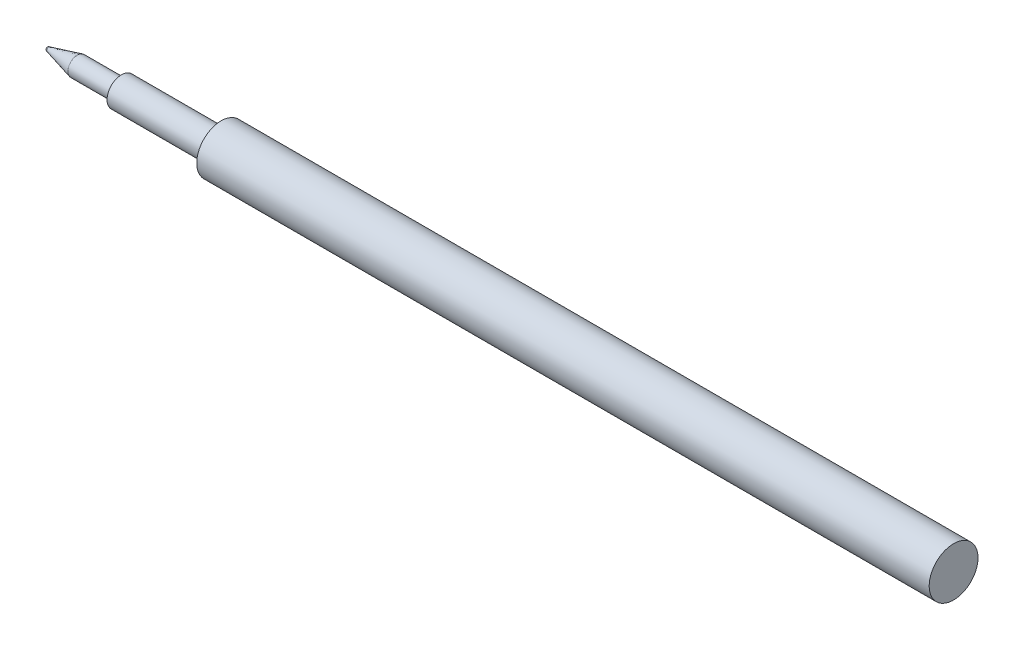
from build123d import *


with BuildPart() as part:
    # Sketch1 → Revolve1 (revolve)
    with BuildSketch(Plane.XY):
        with BuildLine():
            Line((-90, 3), (-90, 1.77))
            Line((-90, 1.77), (-102.25, 1.77))
            Line((-102.25, 1.77), (-102.25, 1.16))
            Line((-102.25, 1.16), (-107.67, 1.16))
            Line((-107.67, 1.16), (-111.17, 0.25))
            ThreePointArc((-111.17, 0.25), (-111.346776695, 0.176776695), (-111.42, 0))
            Line((-111.42, 0), (0, 0))
            Line((0, 0), (0, 3))
            Line((0, 3), (-90, 3))
        make_face()
    revolve(axis=Axis((0, 0, 0), (-1, 0, 0)))


solid = part.part
